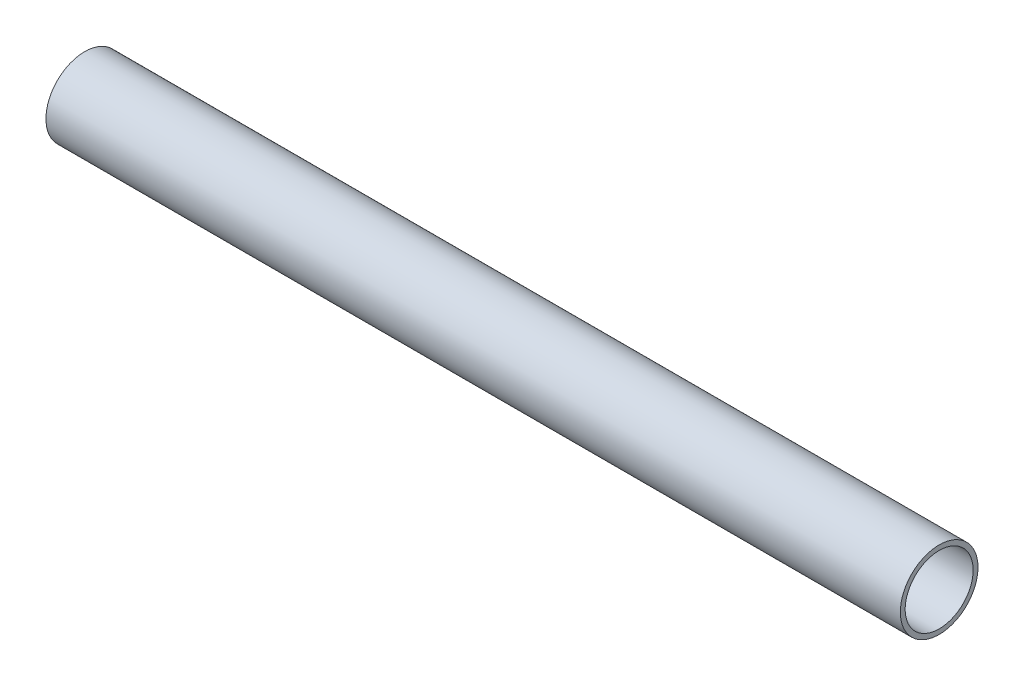
from build123d import *

# Parameters (mm, degrees)
SKETCH1_R           = 25.4
SKETCH1_R_2         = 22.225
BOSS_EXTRUDE1_DEPTH = 279.4


with BuildPart() as part:
    # Sketch1 → Boss-Extrude1 (new, symmetric)
    with BuildSketch(Plane(origin=(0, 0, 0), x_dir=(0, 0, -1), z_dir=(1, 0, 0))):
        Circle(SKETCH1_R)
        Circle(SKETCH1_R_2, mode=Mode.SUBTRACT)
    extrude(amount=BOSS_EXTRUDE1_DEPTH, both=True)


solid = part.part
